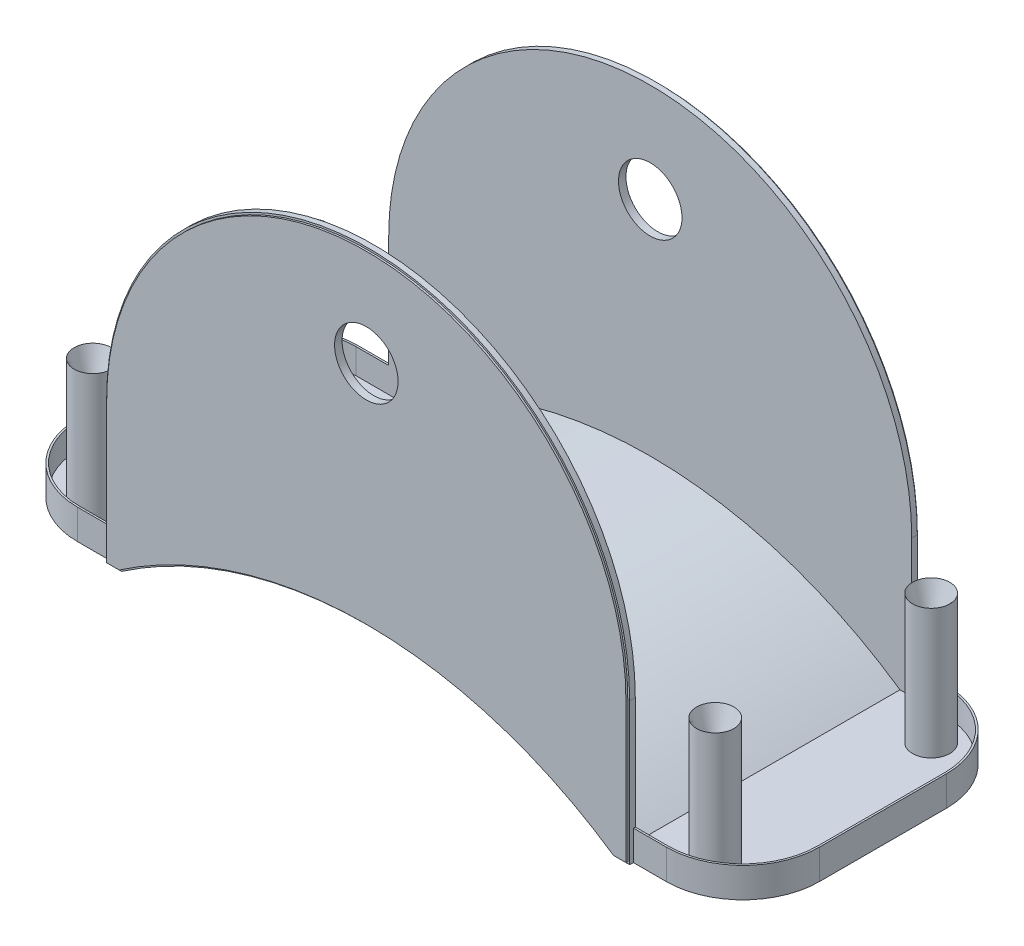
from build123d import *

# Parameters (mm, degrees)
SKETCH1_R           = 8.5
BOSS_EXTRUDE1_DEPTH = 2
CUT_EXTRUDE1_START  = -0.5
CUT_EXTRUDE1_DEPTH  = 0.5
BOSS_EXTRUDE2_START = -37
BOSS_EXTRUDE2_DEPTH = 37
BOSS_EXTRUDE4_DEPTH = 8
BOSS_EXTRUDE5_DEPTH = 1.236037686
SKETCH11_R          = 5
BOSS_EXTRUDE6_DEPTH = 34.7
SKETCH12_R          = 2.8
CUT_EXTRUDE2_DEPTH  = 6
DRAFT1_ANGLE        = -1
SKETCH16_R          = 2.8
CUT_EXTRUDE3_DEPTH  = 29
SKETCH17_R          = 1.35
CUT_EXTRUDE4_DEPTH  = 29


# Read off the part's stored shape, not the designer's step: Mirror5
with BuildPart() as part:
    # Sketch1 → Boss-Extrude1 (new body)
    with BuildSketch(Plane.XY):
        with BuildLine():
            Line((-70, 0), (-70, -38))
            Line((-70, -38), (-66, -38))
            ThreePointArc((-66, -38), (0, -17.5), (66, -38))
            Line((66, -38), (70, -38))
            Line((70, -38), (70, 0))
            ThreePointArc((70, 0), (0, 70), (-70, 0))
        make_face()
        with Locations((0, 43.5)):
            Circle(SKETCH1_R, mode=Mode.SUBTRACT)
    extrude(amount=BOSS_EXTRUDE1_DEPTH)

    # Sketch2 → Cut-Extrude1 (cut)
    with BuildSketch(Plane.XY.offset(2).offset(CUT_EXTRUDE1_START)):
        with BuildLine():
            Line((-70, 0), (-70, -38))
            Line((-70, -38), (-66, -38))
            ThreePointArc((-66, -38), (0, -17.5), (66, -38))
            Line((66, -38), (70, -38))
            Line((70, -38), (70, 0))
            ThreePointArc((70, 0), (0, 70), (-70, 0))
        make_face()
        with BuildLine():
            Line((-69.5, 0), (-69.5, -37.5))
            Line((-69.5, -37.5), (-66.155120739, -37.5))
            ThreePointArc((-66.155120739, -37.5), (0, -17), (66.155120739, -37.5))
            Line((66.155120739, -37.5), (69.5, -37.5))
            Line((69.5, -37.5), (69.5, 0))
            ThreePointArc((69.5, 0), (0, 69.5), (-69.5, 0))
        make_face(mode=Mode.SUBTRACT)
    extrude(amount=CUT_EXTRUDE1_DEPTH, mode=Mode.SUBTRACT)

    # Sketch5 → Boss-Extrude2 (add)
    with BuildSketch(Plane.XY.offset(BOSS_EXTRUDE2_START)):
        with BuildLine():
            Line((66.849829887, -36.763962314), (70, -36.763962314))
            Line((70, -36.763962314), (70, -38))
            Line((70, -38), (66, -38))
            ThreePointArc((66, -38), (0, -17.5), (-66, -38))
            Line((-66, -38), (-70, -38))
            Line((-70, -38), (-70, -36.763962314))
            Line((-70, -36.763962314), (-66.849829887, -36.763962314))
            ThreePointArc((-66.849829887, -36.763962314), (0, -16), (66.849829887, -36.763962314))
        make_face()
    boss_extrude2 = extrude(amount=BOSS_EXTRUDE2_DEPTH)

    # Sketch9 → Boss-Extrude4 (add)
    with BuildSketch(Plane(origin=(0, -38, 0), x_dir=(1, 0, 0), z_dir=(0, 1, 0))):
        with BuildLine():
            ThreePointArc((-78.8, -0.5), (-93.295689014, 5.504310986), (-99.3, 20))
            Line((-99.3, 20), (-99.3, 37))
            Line((-99.3, 37), (-98.8, 37))
            Line((-98.8, 37), (-98.8, 20))
            ThreePointArc((-98.8, 20), (-92.942135624, 5.857864376), (-78.8, 0))
            Line((-78.8, 0), (-70, 0))
            Line((-70, 0), (-70, -0.5))
            Line((-70, -0.5), (-78.8, -0.5))
        make_face()
    boss_extrude4 = extrude(amount=BOSS_EXTRUDE4_DEPTH)

    # Sketch10 → Boss-Extrude5 (add)
    with BuildSketch(Plane(origin=(0, -38, 0), x_dir=(1, 0, 0), z_dir=(0, 1, 0))):
        with BuildLine():
            Line((-70, 0), (-78.8, 0))
            ThreePointArc((-78.8, 0), (-92.942135624, 5.857864376), (-98.8, 20))
            Line((-98.8, 20), (-98.8, 37))
            Line((-98.8, 37), (-70, 37))
            Line((-70, 37), (-70, 0))
        make_face()
    boss_extrude5 = extrude(amount=BOSS_EXTRUDE5_DEPTH)

    # Sketch11 → Boss-Extrude6 (add)
    with BuildSketch(Plane(origin=(0, -36.763962314, 0), x_dir=(1, 0, 0), z_dir=(0, 1, 0))):
        with Locations(Location((-83.3, 8.1, 0), (0, 0, 270))):
            Circle(SKETCH11_R)
    boss_extrude6 = extrude(amount=BOSS_EXTRUDE6_DEPTH)

    # Sketch12 → Cut-Extrude2 (cut)
    with BuildSketch(Plane(origin=(0, -2.063962314, 0), x_dir=(1, 0, 0), z_dir=(0, 1, 0))):
        with Locations(Location((-83.3, 8.1, 0), (0, 0, 270))):
            Circle(SKETCH12_R)
    cut_extrude2 = extrude(amount=-CUT_EXTRUDE2_DEPTH, mode=Mode.SUBTRACT)

    # Draft1
    draft1_faces = [part.faces().sort_by_distance(p)[0] for p in [
        (-83.3, -5.063962314, -10.9),
    ]]
    draft(draft1_faces, Plane(origin=(-83.3, -8.063962314, -8.1), x_dir=(0, 0, 1), z_dir=(0, 1, 0)), DRAFT1_ANGLE)

    # Sketch14 → Cut-Revolve2 (revolve, cut)
    with BuildSketch(Plane.XY.offset(-8.1), mode=Mode.PRIVATE) as cut_revolve2_sk:
        Polygon((-85.99526961, -2.063962314), (-86.1, -8.063962314), (-88.3, -2.063962314), align=None)
    cut_revolve2 = revolve(cut_revolve2_sk.sketch.rotate(Axis((-83.3, -8.063962314, -8.1), (0, 1, 0)), 270), axis=Axis((-83.3, -8.063962314, -8.1), (0, 1, 0)), mode=Mode.SUBTRACT)

    # Mirror3: Boss-Extrude2, Boss-Extrude4, Boss-Extrude5, Boss-Extrude6, Cut-Extrude2, Cut-Revolve2 across plane
    add(boss_extrude2.mirror(Plane(origin=(0, 0, 0), x_dir=(0, 0, 1), z_dir=(1, 0, 0))))
    add(boss_extrude4.mirror(Plane(origin=(0, 0, 0), x_dir=(0, 0, 1), z_dir=(1, 0, 0))))
    add(boss_extrude5.mirror(Plane(origin=(0, 0, 0), x_dir=(0, 0, 1), z_dir=(1, 0, 0))))
    add(boss_extrude6.mirror(Plane(origin=(0, 0, 0), x_dir=(0, 0, 1), z_dir=(1, 0, 0))))
    add(cut_extrude2.mirror(Plane(origin=(0, 0, 0), x_dir=(0, 0, 1), z_dir=(1, 0, 0))), mode=Mode.SUBTRACT)
    add(cut_revolve2.mirror(Plane(origin=(0, 0, 0), x_dir=(0, 0, 1), z_dir=(1, 0, 0))), mode=Mode.SUBTRACT)

    # Mirror5: part across plane


with BuildPart() as part_1:
    add(part.part)
    add(part.part.mirror(Plane(origin=(0, -133.993902439, -37), x_dir=(1, 0, 0), z_dir=(0, 0, 1))))

    # Sketch16 → Cut-Extrude3 (cut)
    with BuildSketch(Plane.XZ.offset(38)):
        with Locations(Location((-83.3, -65.9, 0), (0, 0, 270))):
            Circle(SKETCH16_R)
        with Locations(Location((83.3, -65.9, 0), (0, 0, 270))):
            Circle(SKETCH16_R)
        with Locations(Location((83.3, -8.1, 0), (0, 0, 270))):
            Circle(SKETCH16_R)
        with Locations(Location((-83.3, -8.1, 0), (0, 0, 270))):
            Circle(SKETCH16_R)
    extrude(amount=-CUT_EXTRUDE3_DEPTH, mode=Mode.SUBTRACT)

    # Sketch17 → Cut-Extrude4 (cut)
    with BuildSketch(Plane(origin=(0, -8.063962314, 0), x_dir=(1, 0, 0), z_dir=(0, 1, 0))):
        with Locations(Location((-83.3, 65.9, 0), (0, 0, 270))):
            Circle(SKETCH17_R)
        with Locations(Location((-83.3, 8.1, 0), (0, 0, 270))):
            Circle(SKETCH17_R)
        with Locations(Location((83.3, 65.9, 0), (0, 0, 270))):
            Circle(SKETCH17_R)
        with Locations(Location((83.3, 8.1, 0), (0, 0, 270))):
            Circle(SKETCH17_R)
    extrude(amount=-CUT_EXTRUDE4_DEPTH, mode=Mode.SUBTRACT)


solid = part_1.part
